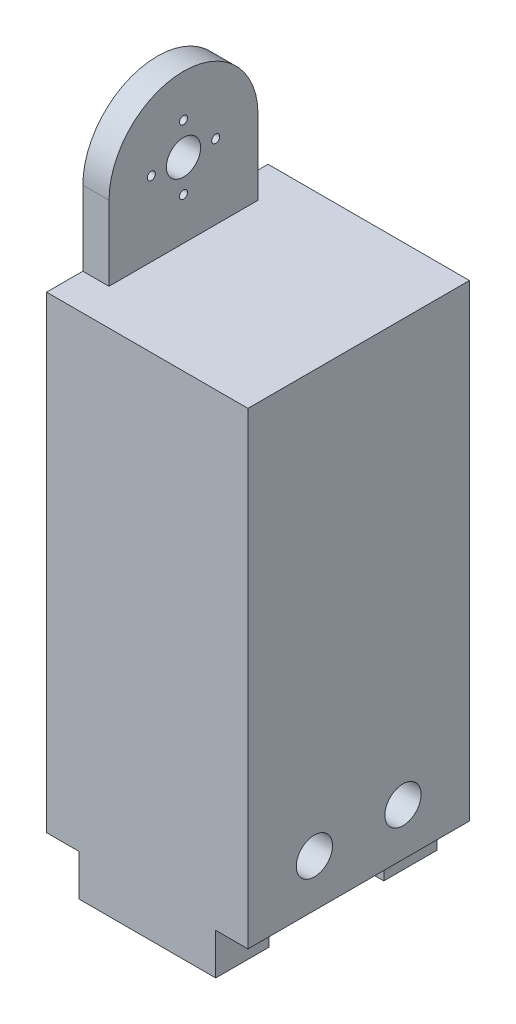
from build123d import *

# Parameters (mm, degrees)
SKETCH1_W               = 50
SKETCH1_H               = 150
BOSS_EXTRUDE1_DEPTH     = 55
CUT_EXTRUDE1_DEPTH      = 168.406690428
CUT_EXTRUDE1_DEPTH_BACK = 45
SKETCH2_R               = 10.25
SKETCH7_R               = 1
SKETCH7_R_2             = 4.25
CUT_EXTRUDE3_DEPTH      = 10
SKETCH8_W               = 55
SKETCH8_H               = 55
SKETCH8_R               = 10.25
BOSS_EXTRUDE2_DEPTH     = 50
CUT_EXTRUDE4_DEPTH      = 214.717102732
SKETCH11_W              = 34
SKETCH11_H              = 13.25
BOSS_EXTRUDE4_DEPTH     = 25
SKETCH13_W              = 55
SKETCH13_H              = 10
CUT_EXTRUDE5_DEPTH      = 8
SKETCH14_R              = 5.030159043
CUT_EXTRUDE6_DEPTH      = 8
SKETCH15_W              = 34
SKETCH15_H              = 0.25
BOSS_EXTRUDE5_DEPTH     = 13.25
CUT_EXTRUDE7_DEPTH      = 181.416185527
BOSS_EXTRUDE6_START     = 1.5
SKETCH19_R              = 10.25
SKETCH19_R_2            = 1
SKETCH19_R_3            = 4.25
BOSS_EXTRUDE6_DEPTH     = 1.5
CUT_EXTRUDE8_DEPTH      = 184.89467094
SKETCH21_R              = 5.030159043
SKETCH21_R_2            = 4.5
BOSS_EXTRUDE7_DEPTH     = 8


with BuildPart() as part:
    # Sketch1 → Boss-Extrude1 (new body)
    with BuildSketch(Plane.XY):
        with Locations((0, -75)):
            Rectangle(SKETCH1_W, SKETCH1_H)
    extrude(amount=-BOSS_EXTRUDE1_DEPTH)

    # Sketch2 → Cut-Extrude1 (cut, two sides: drawn at the far end of the back side and taken through both)
    with BuildSketch(Plane(origin=(25, 0, 0), x_dir=(0, 0, -1), z_dir=(1, 0, 0)).offset(-CUT_EXTRUDE1_DEPTH_BACK)):
        with Locations((27.5, -25)):
            Circle(SKETCH2_R)
    extrude(amount=CUT_EXTRUDE1_DEPTH + CUT_EXTRUDE1_DEPTH_BACK, mode=Mode.SUBTRACT)

    # Sketch7 → Cut-Extrude3 (cut)
    with BuildSketch(Plane(origin=(-20, 0, 0), x_dir=(0, 0, -1), z_dir=(1, 0, 0))):
        with Locations((27.5, -17)):
            Circle(SKETCH7_R)
        with Locations((27.5, -25)):
            Circle(SKETCH7_R_2)
        with Locations((35.5, -25)):
            Circle(SKETCH7_R)
        with Locations((19.5, -25)):
            Circle(SKETCH7_R)
        with Locations((27.5, -33)):
            Circle(SKETCH7_R)
    extrude(amount=-CUT_EXTRUDE3_DEPTH, mode=Mode.SUBTRACT)

    # Sketch8 → Boss-Extrude2 (add)
    with BuildSketch(Plane(origin=(25, 0, 0), x_dir=(0, 0, -1), z_dir=(1, 0, 0))):
        with Locations((27.5, -177.5)):
            Rectangle(SKETCH8_W, SKETCH8_H)
        with Locations((27.5, -180)):
            Circle(SKETCH8_R, mode=Mode.SUBTRACT)
    extrude(amount=-BOSS_EXTRUDE2_DEPTH)

    # Sketch10 → Cut-Extrude4 (cut, through all)
    with BuildSketch(Plane.XY):
        Polygon((25, -205), (25, -169.75), (17, -169.75), (17, -144.75), (-17, -144.75), (-17, -169.75), (-25, -169.75), (-25, -205), align=None)
    extrude(amount=-CUT_EXTRUDE4_DEPTH, mode=Mode.SUBTRACT)

    # Sketch11 → Boss-Extrude4 (add)
    with BuildSketch(Plane.XZ.offset(144.75)):
        with Locations((0, -6.625)):
            Rectangle(SKETCH11_W, SKETCH11_H)
        with Locations((0, -48.375)):
            Rectangle(SKETCH11_W, SKETCH11_H)
    extrude(amount=BOSS_EXTRUDE4_DEPTH)

    # Sketch13 → Cut-Extrude5 (cut)
    with BuildSketch(Plane(origin=(25, 0, 0), x_dir=(0, 0, -1), z_dir=(1, 0, 0))):
        with Locations((27.5, -164.75)):
            Rectangle(SKETCH13_W, SKETCH13_H)
    cut_extrude5 = extrude(amount=-CUT_EXTRUDE5_DEPTH, mode=Mode.SUBTRACT)

    # Mirror2: Cut-Extrude5 across plane
    add(cut_extrude5.mirror(Plane(origin=(0, 0, 0), x_dir=(0, 0, 1), z_dir=(1, 0, 0))), mode=Mode.SUBTRACT)

    # Sketch14 → Cut-Extrude6 (cut)
    with BuildSketch(Plane(origin=(25, 0, 0), x_dir=(0, 0, -1), z_dir=(1, 0, 0))):
        with Locations((16.5, -148)):
            Circle(SKETCH14_R)
        with Locations((38.5, -148)):
            Circle(SKETCH14_R)
    cut_extrude6 = extrude(amount=-CUT_EXTRUDE6_DEPTH, mode=Mode.SUBTRACT)

    # Mirror3: Cut-Extrude6 across plane
    add(cut_extrude6.mirror(Plane(origin=(0, 0, 0), x_dir=(0, 0, 1), z_dir=(1, 0, 0))), mode=Mode.SUBTRACT)

    # Sketch15 → Boss-Extrude5 (add)
    with BuildSketch(Plane.XY):
        with Locations((0, -169.875)):
            Rectangle(SKETCH15_W, SKETCH15_H)
    boss_extrude5 = extrude(amount=-BOSS_EXTRUDE5_DEPTH)

    # Mirror4: Boss-Extrude5 across plane
    add(boss_extrude5.mirror(Plane.XY.offset(-27.5)))

    # Sketch16 → Cut-Extrude7 (cut, through all)
    with BuildSketch(Plane.XY):
        Polygon((-18.5, 0), (-18.5, -14.75), (-18.5, -35.25), (-18.5, -43.5), (25, -43.5), (25, 0), align=None)
    extrude(amount=-CUT_EXTRUDE7_DEPTH, mode=Mode.SUBTRACT)

    # Sketch19 → Boss-Extrude6 (add)
    with BuildSketch(Plane(origin=(-20, 0, 0), x_dir=(0, 0, -1), z_dir=(1, 0, 0)).offset(BOSS_EXTRUDE6_START)):
        with Locations((27.5, -25)):
            Circle(SKETCH19_R)
        with Locations((19.5, -25)):
            Circle(SKETCH19_R_2, mode=Mode.SUBTRACT)
        with Locations((27.5, -33)):
            Circle(SKETCH19_R_2, mode=Mode.SUBTRACT)
        with Locations((27.5, -25)):
            Circle(SKETCH19_R_3, mode=Mode.SUBTRACT)
        with Locations((27.5, -17)):
            Circle(SKETCH19_R_2, mode=Mode.SUBTRACT)
        with Locations((35.5, -25)):
            Circle(SKETCH19_R_2, mode=Mode.SUBTRACT)
    extrude(amount=-BOSS_EXTRUDE6_DEPTH)

    # Sketch20 → Cut-Extrude8 (cut, through all)
    with BuildSketch(Plane(origin=(-18.5, 0, 0), x_dir=(0, 0, -1), z_dir=(1, 0, 0))):
        with BuildLine():
            Line((0, 0), (0, -43.5))
            Line((0, -43.5), (9, -43.5))
            Line((9, -43.5), (9, -25))
            ThreePointArc((9, -25), (27.5, -6.5), (46, -25))
            Line((46, -25), (46, -43.5))
            Line((46, -43.5), (55, -43.5))
            Line((55, -43.5), (55, 0))
            Line((55, 0), (0, 0))
        make_face()
    extrude(amount=-CUT_EXTRUDE8_DEPTH, mode=Mode.SUBTRACT)

    # Sketch21 → Boss-Extrude7 (add)
    # profile 1 of 2: a face of its own
    with BuildSketch(Plane(origin=(25, 0, 0), x_dir=(0, 0, -1), z_dir=(1, 0, 0))):
        with Locations((16.5, -148)):
            Circle(SKETCH21_R)
        with Locations((16.5, -148)):
            Circle(SKETCH21_R_2, mode=Mode.SUBTRACT)
    # profile 2 of 2: a face of its own
    with BuildSketch(Plane(origin=(25, 0, 0), x_dir=(0, 0, -1), z_dir=(1, 0, 0))):
        with Locations((38.5, -148)):
            Circle(SKETCH21_R)
        with Locations((38.5, -148)):
            Circle(SKETCH21_R_2, mode=Mode.SUBTRACT)
    boss_extrude7 = extrude(amount=-BOSS_EXTRUDE7_DEPTH)

    # Mirror5: Boss-Extrude7 across plane
    add(boss_extrude7.mirror(Plane(origin=(0, 0, 0), x_dir=(0, 0, 1), z_dir=(1, 0, 0))))


solid = part.part
